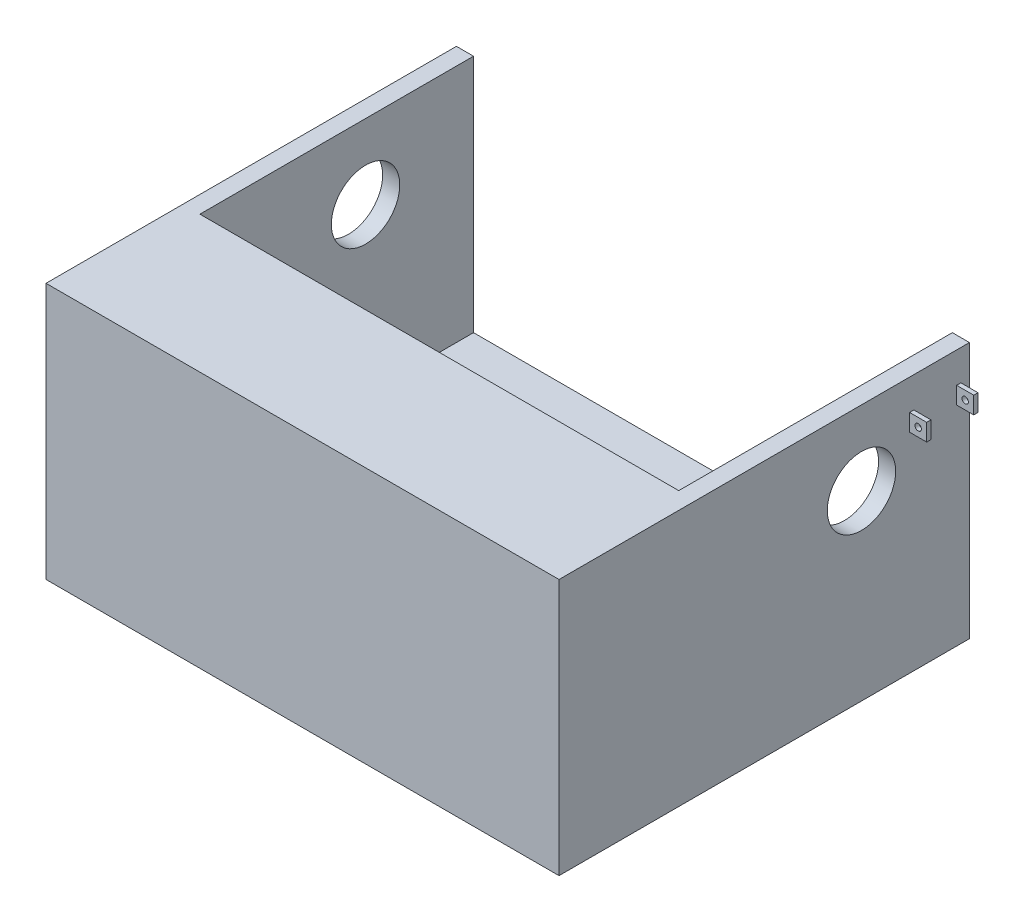
from build123d import *

# Parameters (mm, degrees)
SKETCH1_W           = 762
SKETCH1_H           = 381
BOSS_EXTRUDE1_DEPTH = 609.6
SKETCH3_W           = 711.2
SKETCH3_H           = 330.2
CUT_EXTRUDE2_DEPTH  = 584.2
SKETCH5_W           = 25.4
SKETCH5_H           = 25.4
SKETCH5_R           = 4.7625
BOSS_EXTRUDE2_DEPTH = 38.1
SKETCH7_W           = 63.5
SKETCH7_H           = 25.4
CUT_EXTRUDE4_DEPTH  = 25.4
SKETCH8_W           = 63.5
SKETCH8_H           = 25.4
CUT_EXTRUDE5_DEPTH  = 25.4
SKETCH14_W          = 711.2
SKETCH14_H          = 25.4
CUT_EXTRUDE10_DEPTH = 406.4
SKETCH2_R           = 50.8
CUT_EXTRUDE11_DEPTH = 1067.19506658


with BuildPart() as part:
    # Sketch1 → Boss-Extrude1 (new body)
    with BuildSketch(Plane.XY):
        with Locations((381, 190.5)):
            Rectangle(SKETCH1_W, SKETCH1_H)
    extrude(amount=-BOSS_EXTRUDE1_DEPTH)

    # Sketch3 → Cut-Extrude2 (cut)
    with BuildSketch(Plane(origin=(0, 0, -609.6), x_dir=(-1, 0, 0), z_dir=(0, 0, -1))):
        with Locations((-381, 190.5)):
            Rectangle(SKETCH3_W, SKETCH3_H)
    extrude(amount=-CUT_EXTRUDE2_DEPTH, mode=Mode.SUBTRACT)

    # Sketch5 → Boss-Extrude2 (add, symmetric)
    with BuildSketch(Plane.XY.offset(-558.8)):
        with Locations((774.7, 322.793695431)):
            Rectangle(SKETCH5_W, SKETCH5_H)
        with Locations((774.7, 322.793695431)):
            Circle(SKETCH5_R, mode=Mode.SUBTRACT)
    boss_extrude2 = extrude(amount=BOSS_EXTRUDE2_DEPTH, both=True)

    # Sketch7 → Cut-Extrude4 (cut)
    with BuildSketch(Plane(origin=(787.4, 0, 0), x_dir=(0, 0, -1), z_dir=(1, 0, 0))):
        with Locations((558.8, 322.793695431)):
            Rectangle(SKETCH7_W, SKETCH7_H)
    extrude(amount=-CUT_EXTRUDE4_DEPTH, mode=Mode.SUBTRACT)

    # Mirror3: Boss-Extrude2 across plane
    add(boss_extrude2.mirror(Plane(origin=(381, 0, 0), x_dir=(0, 0, 1), z_dir=(1, 0, 0))))

    # Sketch8 → Cut-Extrude5 (cut)
    with BuildSketch(Plane.ZY.offset(25.4)):
        with Locations((-558.8, 322.793695431)):
            Rectangle(SKETCH8_W, SKETCH8_H)
    extrude(amount=-CUT_EXTRUDE5_DEPTH, mode=Mode.SUBTRACT)

    # Sketch14 → Cut-Extrude10 (cut)
    with BuildSketch(Plane(origin=(0, 0, -609.6), x_dir=(-1, 0, 0), z_dir=(0, 0, -1))):
        with Locations((-381, 368.3)):
            Rectangle(SKETCH14_W, SKETCH14_H)
    extrude(amount=-CUT_EXTRUDE10_DEPTH, mode=Mode.SUBTRACT)

    # Sketch2 → Cut-Extrude11 (cut, through all)
    with BuildSketch(Plane(origin=(762, 0, 0), x_dir=(0, 0, -1), z_dir=(1, 0, 0))):
        with Locations((449.227985658, 270.223084725)):
            Circle(SKETCH2_R)
    extrude(amount=-CUT_EXTRUDE11_DEPTH, mode=Mode.SUBTRACT)


solid = part.part
